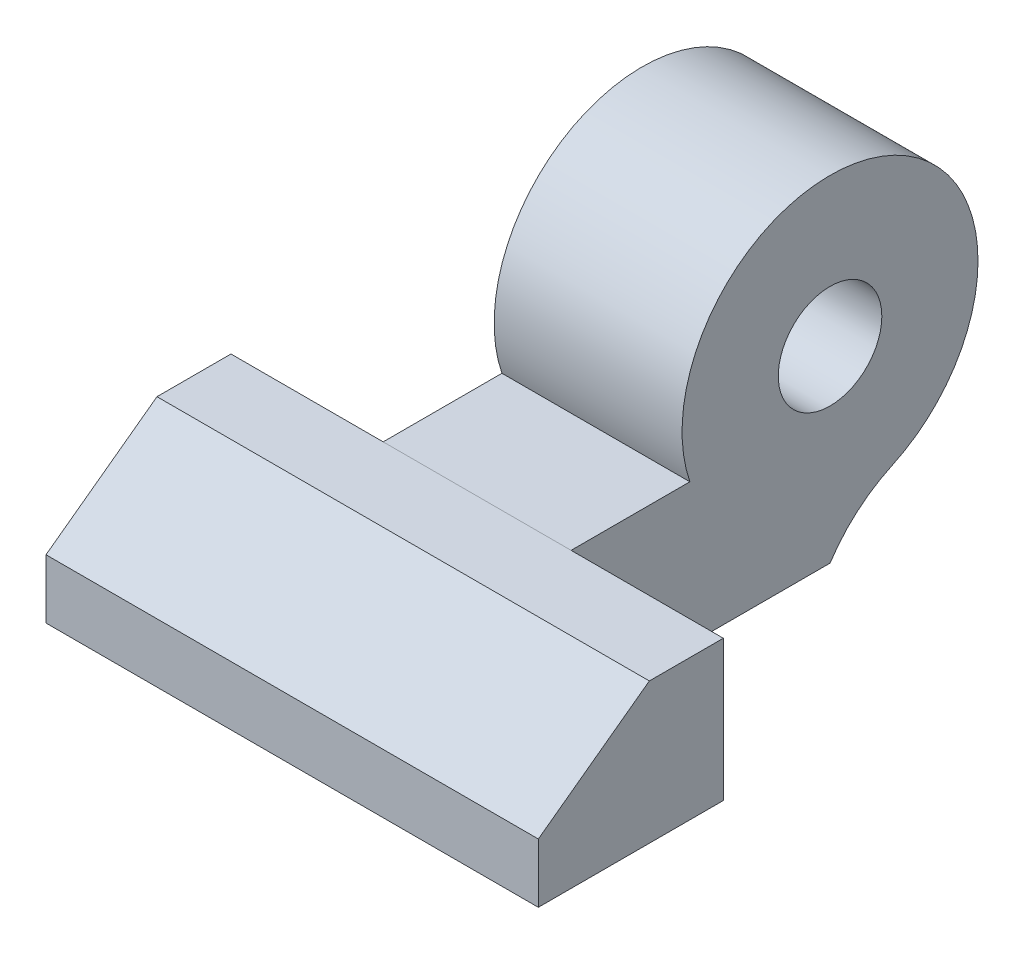
from build123d import *

# Parameters (mm, degrees)
SKETCH1_R           = 3.5
BOSS_EXTRUDE1_DEPTH = 6.35
BOSS_EXTRUDE2_DEPTH = 16.637
FILLET1_R           = 10


with BuildPart() as part:
    # Sketch1 → Boss-Extrude1 (new, symmetric)
    with BuildSketch(Plane(origin=(0, 0, 0), x_dir=(0, 0, -1), z_dir=(1, 0, 0))):
        with BuildLine():
            Line((0, -12.7), (-30, -12.7))
            Line((-30, -12.7), (-30, -8.7))
            Line((-30, -8.7), (-22.5, -3.2))
            Line((-22.5, -3.2), (-9.474175426, -3.2))
            ThreePointArc((-9.474175426, -3.2), (5.830951895, 8.124038405), (0, -10))
            Line((0, -10), (0, -12.7))
        make_face()
        Circle(SKETCH1_R, mode=Mode.SUBTRACT)
    extrude(amount=BOSS_EXTRUDE1_DEPTH, both=True)

    # Fillet1
    # the kernel refuses this fillet: 10 mm, written as the material it adds along each edge
    with BuildSketch(Plane(origin=(-6.35, -10, 0), x_dir=(0, -1, 0), z_dir=(1, 0, 0))) as fillet1_piece_1:
        with BuildLine():
            CenterArc((8.161023622, 8.377184551), FILLET1_R, 204.762586687, 32.137385873)
            Line((-0.919488189, 4.188592275), (-1.101098425, 4.10482043))
            ThreePointArc((-1.101098425, 4.10482043), (-0.427925109, 2.101281105), (-0.2, 0))
            Line((-0.2, 0), (0, -0.2))
            ThreePointArc((0, -0.2), (1.35, -0.2), (2.590779528, -0.167543691))
            Line((2.590779528, -0.167543691), (2.7, 0))
        make_face()
    extrude(amount=12.7)


with BuildPart() as body_2:
    # Sketch4 → Boss-Extrude2 (new, symmetric)
    with BuildSketch(Plane(origin=(0, 0, 0), x_dir=(0, 0, -1), z_dir=(1, 0, 0))):
        Polygon((-17.5, -3.2), (-17.5, -12.7), (-30, -12.7), (-30, -8.7), (-22.5, -3.2), align=None)
    extrude(amount=BOSS_EXTRUDE2_DEPTH, both=True)


solid = Compound([part.part, body_2.part])
